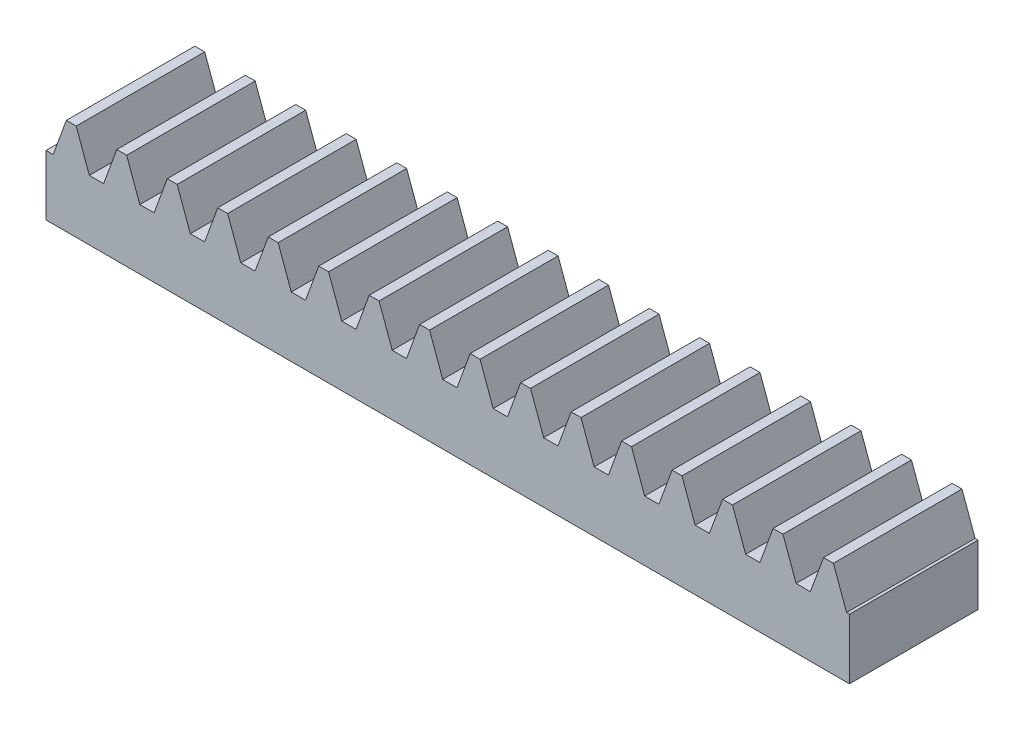
from build123d import *

# Parameters (mm, degrees)
BLANKSKE_W        = 50
BLANKSKE_H        = 6
BLANK_DEPTH       = 8
TOOTHCUTSIM_DEPTH = 51.990195136
TEETHCUTS_COUNT   = 17
TEETHCUTS_PITCH   = 3.14159265


with BuildPart() as part:
    # BlankSke → Blank (new body)
    with BuildSketch(Plane.XY):
        with Locations((25, 3)):
            Rectangle(BLANKSKE_W, BLANKSKE_H)
    extrude(amount=-BLANK_DEPTH)

    # TooCutSkeSim → ToothCutSim (cut, through all)
    with BuildSketch(Plane.XY):
        Polygon((0.44443537, 3.75), (-0.44443537, 3.75), (-1.272613241, 6.0254), (1.272613241, 6.0254), align=None)
    toothcutsim = extrude(amount=-TOOTHCUTSIM_DEPTH, mode=Mode.SUBTRACT)

    # TeethCuts: ToothCutSim ×17
    with Locations(*[(i * TEETHCUTS_PITCH, 0, 0) for i in range(1, TEETHCUTS_COUNT)]):
        add(toothcutsim, mode=Mode.SUBTRACT)


solid = part.part
